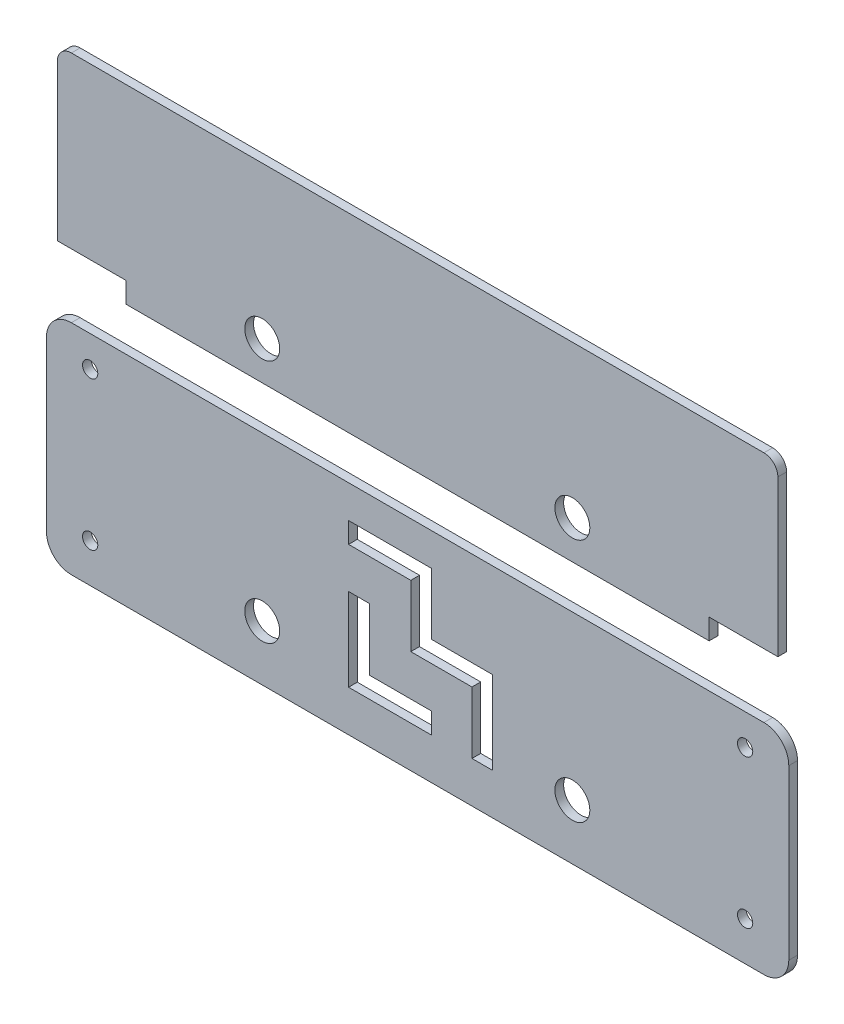
from build123d import *

# Parameters (mm, degrees)
SKETCH1_R             = 5.08
BOSS_EXTRUDE1_DEPTH   = 2.54
BOSS_EXTRUDE1_2_DEPTH = 2.54
CUT_EXTRUDE1_DEPTH    = 147.965122138
SKETCH8_R             = 2.2225
CUT_EXTRUDE4_DEPTH    = 147.965122138


with BuildPart() as part:
    # Sketch1 → Boss-Extrude1 (new body)
    with BuildSketch(Plane.XY):
        with BuildLine():
            Line((-52.6295, -31.75), (-37.7705, -31.75))
            Line((-37.7705, -31.75), (37.5705, -31.75))
            Line((37.5705, -31.75), (52.4295, -31.75))
            Line((52.4295, -31.75), (100.711, -31.75))
            ThreePointArc((100.711, -31.75), (105.829745989, -29.629745989), (107.95, -24.511))
            Line((107.95, -24.511), (107.95, 24.511))
            ThreePointArc((107.95, 24.511), (105.829745989, 29.629745989), (100.711, 31.75))
            Line((100.711, 31.75), (-100.711, 31.75))
            ThreePointArc((-100.711, 31.75), (-105.829745989, 29.629745989), (-107.95, 24.511))
            Line((-107.95, 24.511), (-107.95, -24.511))
            ThreePointArc((-107.95, -24.511), (-105.829745989, -29.629745989), (-100.711, -31.75))
            Line((-100.711, -31.75), (-52.6295, -31.75))
        make_face()
        with Locations((-45.2, -15.6502)):
            Circle(SKETCH1_R, mode=Mode.SUBTRACT)
        with Locations((45, -15.6502)):
            Circle(SKETCH1_R, mode=Mode.SUBTRACT)
    extrude(amount=BOSS_EXTRUDE1_DEPTH)

    # Sketch2 → Cut-Extrude1 (cut, through all)
    with BuildSketch(Plane.XY.offset(2.54)):
        Polygon((-20.086392144, 22.236562491), (3.984117021, 22.236562491), (3.984117021, 4.354393448), (21.823607856, 4.354393448), (21.823607856, -19.758793925), (15.805980564, -19.758793925), (15.805980564, -1.748590259), (-1.990832063, -1.748590259), (-1.990832063, 16.218935199), (-20.086392144, 16.218935199), align=None)
        Polygon((-20.086392144, 4.354393448), (-14.026086645, 4.354393448), (-14.026086645, -13.698488426), (3.984117021, -13.698488426), (3.984117021, -19.758793925), (-20.086392144, -19.758793925), align=None)
    extrude(amount=-CUT_EXTRUDE1_DEPTH, mode=Mode.SUBTRACT)

    # Sketch8 → Cut-Extrude4 (cut, through all)
    with BuildSketch(Plane.XY.offset(2.54)):
        with Locations((-95.25, 22.75)):
            Circle(SKETCH8_R)
        with Locations((-95.25, -20.43)):
            Circle(SKETCH8_R)
        with Locations((95.25, -20.43)):
            Circle(SKETCH8_R)
        with Locations((95.25, 22.75)):
            Circle(SKETCH8_R)
    extrude(amount=-CUT_EXTRUDE4_DEPTH, mode=Mode.SUBTRACT)


with BuildPart() as body_2:
    # Sketch1 → Boss-Extrude1 2 (new body)
    with BuildSketch(Plane.XY):
        with BuildLine():
            Line((100.711, 99.695), (-100.711, 99.695))
            ThreePointArc((-100.711, 99.695), (-103.584681959, 98.504681959), (-104.775, 95.631))
            Line((-104.775, 95.631), (-104.775, 50.345))
            Line((-104.775, 50.345), (-84.775, 50.345))
            Line((-84.775, 50.345), (-84.775, 44.345))
            Line((-84.775, 44.345), (84.775, 44.345))
            Line((84.775, 44.345), (84.775, 50.345))
            Line((84.775, 50.345), (104.775, 50.345))
            Line((104.775, 50.345), (104.775, 95.631))
            ThreePointArc((104.775, 95.631), (103.584681959, 98.504681959), (100.711, 99.695))
        make_face()
        with Locations((-45.2, 55.4698)):
            Circle(SKETCH1_R, mode=Mode.SUBTRACT)
        with Locations((45, 55.4698)):
            Circle(SKETCH1_R, mode=Mode.SUBTRACT)
    extrude(amount=BOSS_EXTRUDE1_2_DEPTH)


solid = Compound([part.part, body_2.part])
